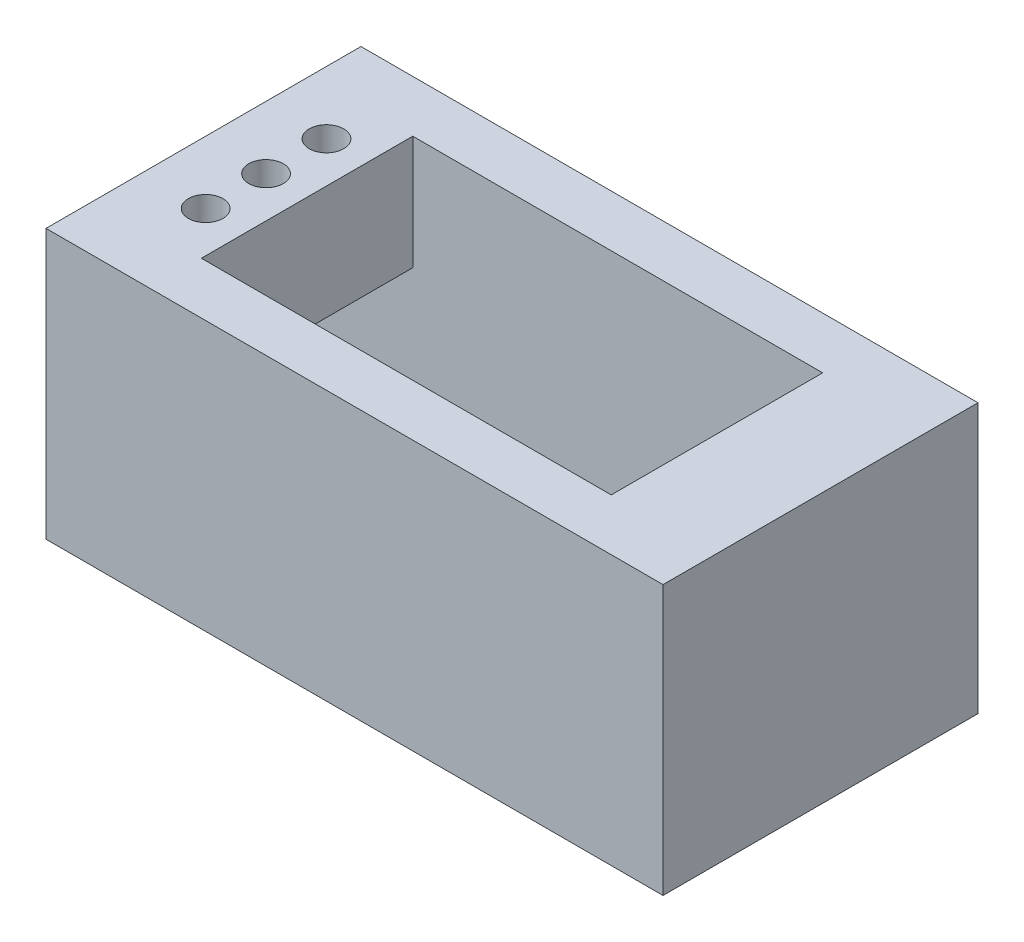
from build123d import *

# Parameters (mm, degrees)
SKETCH1_W           = 35.75
SKETCH1_H           = 18.25
SKETCH1_W_2         = 23.75
SKETCH1_H_2         = 12.25
BOSS_EXTRUDE1_DEPTH = 15.6
SKETCH2_W           = 12.25
SKETCH2_H           = 9
CUT_EXTRUDE1_DEPTH  = 10
SKETCH3_R           = 1
CUT_EXTRUDE2_DEPTH  = 3


with BuildPart() as part:
    # Sketch1 → Boss-Extrude1 (new body)
    with BuildSketch(Plane(origin=(0, 0, 0), x_dir=(1, 0, 0), z_dir=(0, 1, 0))):
        Rectangle(SKETCH1_W, SKETCH1_H)
        Rectangle(SKETCH1_W_2, SKETCH1_H_2, mode=Mode.SUBTRACT)
    extrude(amount=BOSS_EXTRUDE1_DEPTH)

    # Sketch2 → Cut-Extrude1 (cut)
    with BuildSketch(Plane.ZY.offset(17.875)):
        with Locations((0, 4.5)):
            Rectangle(SKETCH2_W, SKETCH2_H)
    extrude(amount=-CUT_EXTRUDE1_DEPTH, mode=Mode.SUBTRACT)

    # Sketch3 → Cut-Extrude2 (cut)
    with BuildSketch(Plane(origin=(0, 15.6, 0), x_dir=(1, 0, 0), z_dir=(0, 1, 0))):
        with Locations((-14.245, 3.495)):
            Circle(SKETCH3_R)
        with Locations((-14.245, -0.005)):
            Circle(SKETCH3_R)
        with Locations((-14.245, -3.505)):
            Circle(SKETCH3_R)
    extrude(amount=-CUT_EXTRUDE2_DEPTH, mode=Mode.SUBTRACT)


solid = part.part
